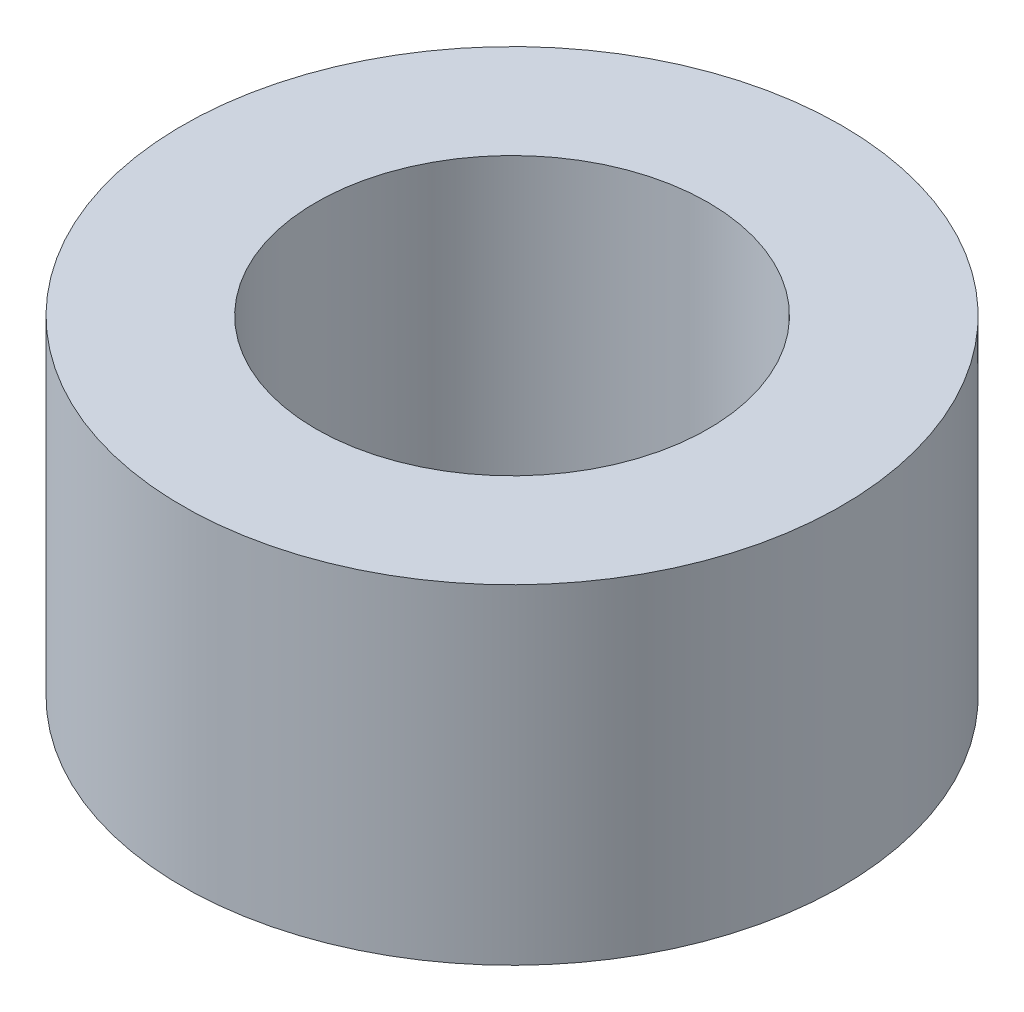
from build123d import *

# Parameters (mm, degrees)
CROQUIS1_R              = 21
CROQUIS1_R_2            = 12.5
SALIENTE_EXTRUIR1_DEPTH = 21


with BuildPart() as part:
    # Croquis1 → Saliente-Extruir1 (new body)
    with BuildSketch(Plane(origin=(0, 0, 0), x_dir=(1, 0, 0), z_dir=(0, 1, 0))):
        Circle(CROQUIS1_R)
        Circle(CROQUIS1_R_2, mode=Mode.SUBTRACT)
    extrude(amount=SALIENTE_EXTRUIR1_DEPTH)


solid = part.part
